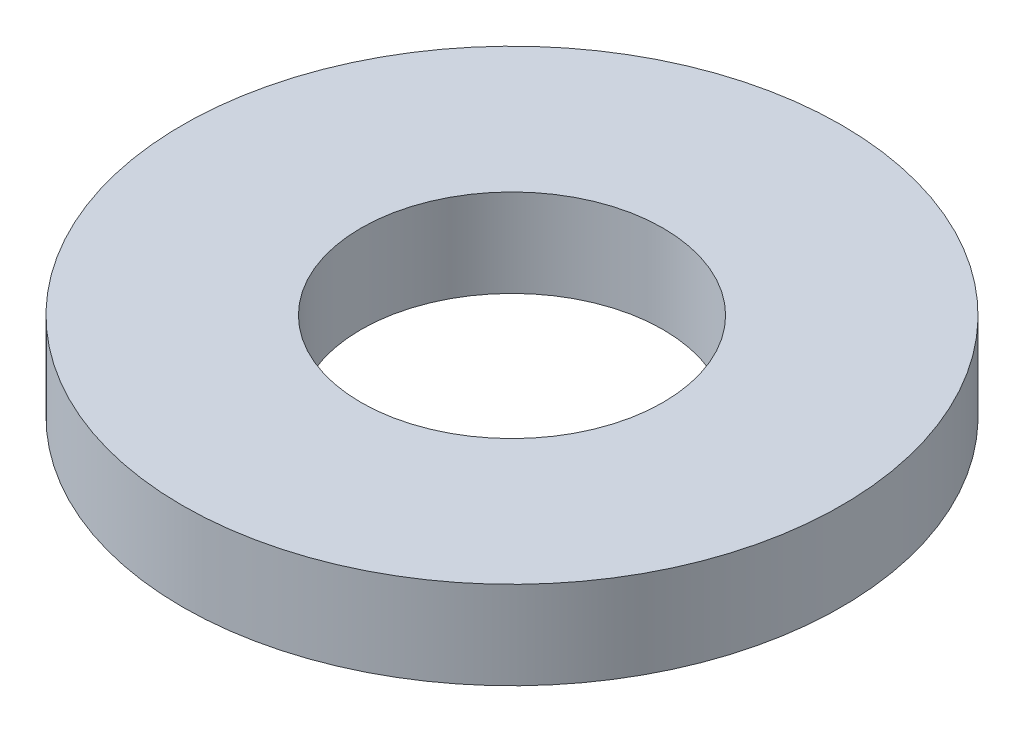
from build123d import *

# Parameters (mm, degrees)
SKETCH1_R           = 60
BOSS_EXTRUDE1_DEPTH = 16
SKETCH2_R           = 27.5
CUT_EXTRUDE1_DEPTH  = 87.34813258


with BuildPart() as part:
    # Sketch1 → Boss-Extrude1 (new body)
    with BuildSketch(Plane(origin=(0, 0, 0), x_dir=(1, 0, 0), z_dir=(0, 1, 0))):
        Circle(SKETCH1_R)
    extrude(amount=BOSS_EXTRUDE1_DEPTH)

    # Sketch2 → Cut-Extrude1 (cut, through all)
    with BuildSketch(Plane(origin=(0, 0, 0), x_dir=(1, 0, 0), z_dir=(0, 1, 0))):
        Circle(SKETCH2_R)
    extrude(amount=CUT_EXTRUDE1_DEPTH, mode=Mode.SUBTRACT)


solid = part.part
